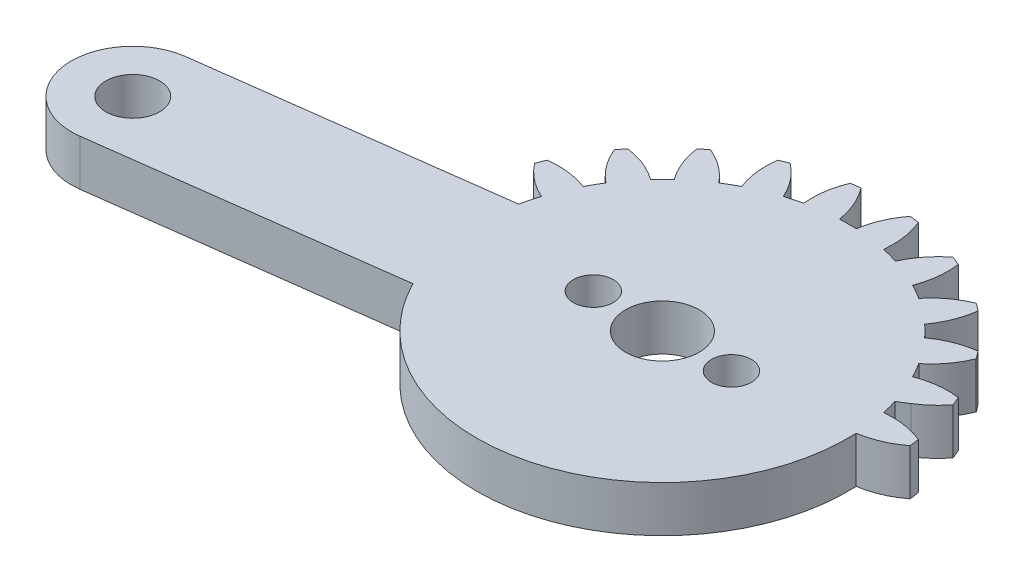
from build123d import *
from build123d.topology import SkipClean

# Parameters (mm, degrees)
SKETCH1_R           = 1.5
BOSS_EXTRUDE1_DEPTH = 3
BOSS_EXTRUDE2_START = -3
SKETCH3_R           = 1.5
SKETCH3_R_2         = 1.75
BOSS_EXTRUDE2_DEPTH = 3
CUT_EXTRUDE1_START  = -4
CUT_EXTRUDE1_DEPTH  = 4
CUT_EXTRUDE2_REACH  = 48.999
SKETCH5_R           = 2.4
SKETCH5_R_2         = 1.3


with BuildPart() as part:
    # Sketch1 → Boss-Extrude1 (new body)
    with BuildSketch(Plane(origin=(0, 0, 0), x_dir=(1, 0, 0), z_dir=(0, 1, 0))):
        with BuildLine():
            Line((20.643657446, 4), (2.081641936, 4))
            ThreePointArc((2.081641936, 4), (2.861028333, 4.588201733), (3.521749436, 5.30713988))
            ThreePointArc((3.521749436, 5.30713988), (3.405395609, 5.596745198), (3.282888305, 5.883801663))
            ThreePointArc((3.282888305, 5.883801663), (1.93527598, 5.894040025), (0.627094961, 5.57027124))
            ThreePointArc((0.627094961, 5.57027124), (0.366286148, 6.046375), (0.084372603, 6.510293938))
            ThreePointArc((0.084372603, 6.510293938), (1.018855105, 7.48132754), (1.683794586, 8.65351323))
            ThreePointArc((1.683794586, 8.65351323), (1.496450048, 8.903135899), (1.303821399, 9.148703928))
            ThreePointArc((1.303821399, 9.148703928), (-0.000522033, 8.809805691), (-1.180330337, 8.158486898))
            ThreePointArc((-1.180330337, 8.158486898), (-1.555477026, 8.550865528), (-1.947855656, 8.926012217))
            ThreePointArc((-1.947855656, 8.926012217), (-1.296536862, 10.105820521), (-0.957638625, 11.410163953))
            ThreePointArc((-0.957638625, 11.410163953), (-1.203206655, 11.602792602), (-1.452829324, 11.79013714))
            ThreePointArc((-1.452829324, 11.79013714), (-2.625015014, 11.125197659), (-3.596048616, 10.190715157))
            ThreePointArc((-3.596048616, 10.190715157), (-4.059967554, 10.472628702), (-4.536071314, 10.733437515))
            ThreePointArc((-4.536071314, 10.733437515), (-4.212302529, 12.041618533), (-4.222540891, 13.389230859))
            ThreePointArc((-4.222540891, 13.389230859), (-4.509597355, 13.511738163), (-4.799202674, 13.62809199))
            ThreePointArc((-4.799202674, 13.62809199), (-5.759348103, 12.682425791), (-6.455432668, 11.528463019))
            ThreePointArc((-6.455432668, 11.528463019), (-6.976508546, 11.680699536), (-7.503891752, 11.809396783))
            ThreePointArc((-7.503891752, 11.809396783), (-7.529737283, 13.156800143), (-7.888414517, 14.455843809))
            ThreePointArc((-7.888414517, 14.455843809), (-8.197396993, 14.499881098), (-8.507248835, 14.537314892))
            ThreePointArc((-8.507248835, 14.537314892), (-9.18992168, 13.375367565), (-9.563620196, 12.080565177))
            ThreePointArc((-9.563620196, 12.080565177), (-10.106342554, 12.09275), (-10.649064912, 12.080565177))
            ThreePointArc((-10.649064912, 12.080565177), (-11.022763428, 13.375367565), (-11.705436272, 14.537314892))
            ThreePointArc((-11.705436272, 14.537314892), (-12.015288115, 14.499881098), (-12.324270591, 14.455843809))
            ThreePointArc((-12.324270591, 14.455843809), (-12.682947825, 13.156800143), (-12.708793355, 11.809396783))
            ThreePointArc((-12.708793355, 11.809396783), (-13.236176561, 11.680699536), (-13.757252439, 11.528463019))
            ThreePointArc((-13.757252439, 11.528463019), (-14.453337005, 12.682425791), (-15.413482434, 13.62809199))
            ThreePointArc((-15.413482434, 13.62809199), (-15.703087752, 13.511738163), (-15.990144217, 13.389230859))
            ThreePointArc((-15.990144217, 13.389230859), (-16.000382579, 12.041618533), (-15.676613793, 10.733437515))
            ThreePointArc((-15.676613793, 10.733437515), (-16.152717554, 10.472628702), (-16.616636492, 10.190715157))
            ThreePointArc((-16.616636492, 10.190715157), (-17.587670094, 11.125197659), (-18.759855783, 11.79013714))
            ThreePointArc((-18.759855783, 11.79013714), (-19.009478453, 11.602792602), (-19.255046482, 11.410163953))
            ThreePointArc((-19.255046482, 11.410163953), (-18.916148245, 10.105820521), (-18.264829452, 8.926012217))
            ThreePointArc((-18.264829452, 8.926012217), (-18.657208082, 8.550865528), (-19.032354771, 8.158486898))
            ThreePointArc((-19.032354771, 8.158486898), (-20.212163074, 8.809805691), (-21.516506507, 9.148703928))
            ThreePointArc((-21.516506507, 9.148703928), (-21.709135156, 8.903135899), (-21.896479694, 8.65351323))
            ThreePointArc((-21.896479694, 8.65351323), (-21.231540213, 7.48132754), (-20.297057711, 6.510293938))
            ThreePointArc((-20.297057711, 6.510293938), (-20.578971255, 6.046375), (-20.839780068, 5.57027124))
            ThreePointArc((-20.839780068, 5.57027124), (-22.147961087, 5.894040025), (-23.495573413, 5.883801663))
            ThreePointArc((-23.495573413, 5.883801663), (-23.618080717, 5.596745198), (-23.734434544, 5.30713988))
            ThreePointArc((-23.734434544, 5.30713988), (-22.788768345, 4.346994451), (-21.634805572, 3.650909885))
            ThreePointArc((-21.634805572, 3.650909885), (-21.78704209, 3.129834008), (-21.915739337, 2.602450802))
            ThreePointArc((-21.915739337, 2.602450802), (-23.263142697, 2.576605271), (-24.562186363, 2.217928037))
            ThreePointArc((-24.562186363, 2.217928037), (-24.606223651, 1.908945561), (-24.643657446, 1.599093719))
            ThreePointArc((-24.643657446, 1.599093719), (-23.481710119, 0.916420874), (-22.186907731, 0.542722358))
            ThreePointArc((-22.186907731, 0.542722358), (-22.199092554, 0), (-22.186907731, -0.542722358))
            ThreePointArc((-22.186907731, -0.542722358), (-23.481710119, -0.916420874), (-24.643657446, -1.599093719))
            ThreePointArc((-24.643657446, -1.599093719), (-24.606223651, -1.908945561), (-24.562186363, -2.217928037))
            ThreePointArc((-24.562186363, -2.217928037), (-23.263142697, -2.576605271), (-21.915739337, -2.602450802))
            ThreePointArc((-21.915739337, -2.602450802), (-21.78704209, -3.129834008), (-21.634805572, -3.650909885))
            ThreePointArc((-21.634805572, -3.650909885), (-22.788768345, -4.346994451), (-23.734434544, -5.30713988))
            ThreePointArc((-23.734434544, -5.30713988), (-23.618080717, -5.596745198), (-23.495573413, -5.883801663))
            ThreePointArc((-23.495573413, -5.883801663), (-22.147961087, -5.894040025), (-20.839780068, -5.57027124))
            ThreePointArc((-20.839780068, -5.57027124), (-20.578971255, -6.046375), (-20.297057711, -6.510293938))
            ThreePointArc((-20.297057711, -6.510293938), (-21.231540213, -7.48132754), (-21.896479694, -8.65351323))
            ThreePointArc((-21.896479694, -8.65351323), (-21.709135156, -8.903135899), (-21.516506507, -9.148703928))
            ThreePointArc((-21.516506507, -9.148703928), (-20.212163074, -8.809805691), (-19.032354771, -8.158486898))
            ThreePointArc((-19.032354771, -8.158486898), (-18.657208082, -8.550865528), (-18.264829452, -8.926012217))
            ThreePointArc((-18.264829452, -8.926012217), (-18.916148245, -10.105820521), (-19.255046482, -11.410163953))
            ThreePointArc((-19.255046482, -11.410163953), (-19.009478453, -11.602792602), (-18.759855783, -11.79013714))
            ThreePointArc((-18.759855783, -11.79013714), (-17.587670094, -11.125197659), (-16.616636492, -10.190715157))
            ThreePointArc((-16.616636492, -10.190715157), (-16.152717554, -10.472628702), (-15.676613793, -10.733437515))
            ThreePointArc((-15.676613793, -10.733437515), (-16.000382579, -12.041618533), (-15.990144217, -13.389230859))
            ThreePointArc((-15.990144217, -13.389230859), (-15.703087752, -13.511738163), (-15.413482434, -13.62809199))
            ThreePointArc((-15.413482434, -13.62809199), (-14.453337005, -12.682425791), (-13.757252439, -11.528463019))
            ThreePointArc((-13.757252439, -11.528463019), (-13.236176561, -11.680699536), (-12.708793355, -11.809396783))
            ThreePointArc((-12.708793355, -11.809396783), (-12.682947825, -13.156800143), (-12.324270591, -14.455843809))
            ThreePointArc((-12.324270591, -14.455843809), (-12.015288115, -14.499881098), (-11.705436272, -14.537314892))
            ThreePointArc((-11.705436272, -14.537314892), (-11.022763428, -13.375367565), (-10.649064912, -12.080565177))
            ThreePointArc((-10.649064912, -12.080565177), (-10.106342554, -12.09275), (-9.563620196, -12.080565177))
            ThreePointArc((-9.563620196, -12.080565177), (-9.18992168, -13.375367565), (-8.507248835, -14.537314892))
            ThreePointArc((-8.507248835, -14.537314892), (-8.197396993, -14.499881098), (-7.888414517, -14.455843809))
            ThreePointArc((-7.888414517, -14.455843809), (-7.529737283, -13.156800143), (-7.503891752, -11.809396783))
            ThreePointArc((-7.503891752, -11.809396783), (-6.976508546, -11.680699536), (-6.455432668, -11.528463019))
            ThreePointArc((-6.455432668, -11.528463019), (-5.759348103, -12.682425791), (-4.799202674, -13.62809199))
            ThreePointArc((-4.799202674, -13.62809199), (-4.509597355, -13.511738163), (-4.222540891, -13.389230859))
            ThreePointArc((-4.222540891, -13.389230859), (-4.212302529, -12.041618533), (-4.536071314, -10.733437515))
            ThreePointArc((-4.536071314, -10.733437515), (-4.059967554, -10.472628702), (-3.596048616, -10.190715157))
            ThreePointArc((-3.596048616, -10.190715157), (-2.625015014, -11.125197659), (-1.452829324, -11.79013714))
            ThreePointArc((-1.452829324, -11.79013714), (-1.203206655, -11.602792602), (-0.957638625, -11.410163953))
            ThreePointArc((-0.957638625, -11.410163953), (-1.296536862, -10.105820521), (-1.947855656, -8.926012217))
            ThreePointArc((-1.947855656, -8.926012217), (-1.555477026, -8.550865528), (-1.180330337, -8.158486898))
            ThreePointArc((-1.180330337, -8.158486898), (-0.000522033, -8.809805691), (1.303821399, -9.148703928))
            ThreePointArc((1.303821399, -9.148703928), (1.496450048, -8.903135899), (1.683794586, -8.65351323))
            ThreePointArc((1.683794586, -8.65351323), (1.018855105, -7.48132754), (0.084372603, -6.510293938))
            ThreePointArc((0.084372603, -6.510293938), (0.366286148, -6.046375), (0.627094961, -5.57027124))
            ThreePointArc((0.627094961, -5.57027124), (1.93527598, -5.894040025), (3.282888305, -5.883801663))
            ThreePointArc((3.282888305, -5.883801663), (3.405395609, -5.596745198), (3.521749436, -5.30713988))
            ThreePointArc((3.521749436, -5.30713988), (2.861028333, -4.588201733), (2.081641936, -4))
            Line((2.081641936, -4), (20.643657446, -4))
            ThreePointArc((20.643657446, -4), (24.643657446, 0), (20.643657446, 4))
        make_face()
        with Locations((-10.106342554, 0)):
            Circle(SKETCH1_R, mode=Mode.SUBTRACT)
        with Locations((20.643657446, 0)):
            Circle(SKETCH1_R, mode=Mode.SUBTRACT)
    extrude(amount=BOSS_EXTRUDE1_DEPTH)

    # Sketch3 → Boss-Extrude2 (add)
    with BuildSketch(Plane(origin=(0, 3, 0), x_dir=(1, 0, 0), z_dir=(0, 1, 0)).offset(BOSS_EXTRUDE2_START)):
        with BuildLine():
            Line((-10.628447323, 3.965779445), (-41.11537681, -0.047900965))
            ThreePointArc((-41.11537681, -0.047900965), (-44.559051487, -4.53578518), (-40.071167272, -7.979459856))
            Line((-40.071167272, -7.979459856), (-9.584237785, -3.965779445))
            ThreePointArc((-9.584237785, -3.965779445), (-6.140563108, 0.522104769), (-10.628447323, 3.965779445))
        make_face()
        with Locations((-10.106342554, 0)):
            Circle(SKETCH3_R, mode=Mode.SUBTRACT)
        with Locations((-40.593272041, -4.013680411)):
            Circle(SKETCH3_R_2, mode=Mode.SUBTRACT)
    extrude(amount=BOSS_EXTRUDE2_DEPTH)

    # Sketch4 → Cut-Extrude1 (cut)
    with SkipClean():  # the faces are left unmerged after this step: merging them gives an invalid solid
        with BuildSketch(Plane(origin=(0, 3, 0), x_dir=(1, 0, 0), z_dir=(0, 1, 0)).offset(CUT_EXTRUDE1_START)):
            with BuildLine():
                ThreePointArc((20.643657446, -4), (24.643657446, 0), (20.643657446, 4))
                Line((20.643657446, 4), (2.081641936, 4))
                Line((2.081641936, 4), (1.43808022, 3.600125745))
                ThreePointArc((1.43808022, 3.600125745), (1.581217534, 3.104116905), (1.70305423, 2.602450802))
                ThreePointArc((1.70305423, 2.602450802), (3.050457589, 2.576605271), (4.349501255, 2.217928037))
                ThreePointArc((4.349501255, 2.217928037), (4.393538544, 1.908945561), (4.430972339, 1.599093719))
                ThreePointArc((4.430972339, 1.599093719), (3.269025011, 0.916420874), (1.974222624, 0.542722358))
                ThreePointArc((1.974222624, 0.542722358), (1.70305423, -2.602450802), (0.627094961, -5.57027124))
                ThreePointArc((0.627094961, -5.57027124), (1.93527598, -5.894040025), (3.282888305, -5.883801663))
                ThreePointArc((3.282888305, -5.883801663), (3.405395609, -5.596745198), (3.521749436, -5.30713988))
                ThreePointArc((3.521749436, -5.30713988), (2.861028333, -4.588201733), (2.081641936, -4))
                Line((2.081641936, -4), (20.643657446, -4))
            make_face()
            with BuildLine():
                ThreePointArc((1.683794586, -8.65351323), (1.018855105, -7.48132754), (0.084372603, -6.510293938))
                ThreePointArc((0.084372603, -6.510293938), (-0.512518948, -7.361599771), (-1.180330337, -8.158486898))
                ThreePointArc((-1.180330337, -8.158486898), (-0.000522033, -8.809805691), (1.303821399, -9.148703928))
                ThreePointArc((1.303821399, -9.148703928), (1.496450048, -8.903135899), (1.683794586, -8.65351323))
            make_face()
            with BuildLine():
                ThreePointArc((-0.957638625, -11.410163953), (-1.296536862, -10.105820521), (-1.947855656, -8.926012217))
                ThreePointArc((-1.947855656, -8.926012217), (-2.744742783, -9.593823606), (-3.596048616, -10.190715157))
                ThreePointArc((-3.596048616, -10.190715157), (-2.625015014, -11.125197659), (-1.452829324, -11.79013714))
                ThreePointArc((-1.452829324, -11.79013714), (-1.203206655, -11.602792602), (-0.957638625, -11.410163953))
            make_face()
            with BuildLine():
                ThreePointArc((-4.222540891, -13.389230859), (-4.212302529, -12.041618533), (-4.536071314, -10.733437515))
                ThreePointArc((-4.536071314, -10.733437515), (-5.478647477, -11.172244217), (-6.455432668, -11.528463019))
                ThreePointArc((-6.455432668, -11.528463019), (-5.759348103, -12.682425791), (-4.799202674, -13.62809199))
                ThreePointArc((-4.799202674, -13.62809199), (-4.509597355, -13.511738163), (-4.222540891, -13.389230859))
            make_face()
            with BuildLine():
                ThreePointArc((-7.888414517, -14.455843809), (-7.529737283, -13.156800143), (-7.503891752, -11.809396783))
                ThreePointArc((-7.503891752, -11.809396783), (-8.527921943, -11.989294847), (-9.563620196, -12.080565177))
                ThreePointArc((-9.563620196, -12.080565177), (-9.18992168, -13.375367565), (-8.507248835, -14.537314892))
                ThreePointArc((-8.507248835, -14.537314892), (-8.197396993, -14.499881098), (-7.888414517, -14.455843809))
            make_face()
            with BuildLine():
                ThreePointArc((-11.705436272, -14.537314892), (-11.022763428, -13.375367565), (-10.649064912, -12.080565177))
                ThreePointArc((-10.649064912, -12.080565177), (-11.684763165, -11.989294847), (-12.708793355, -11.809396783))
                ThreePointArc((-12.708793355, -11.809396783), (-12.682947825, -13.156800143), (-12.324270591, -14.455843809))
                ThreePointArc((-12.324270591, -14.455843809), (-12.015288115, -14.499881098), (-11.705436272, -14.537314892))
            make_face()
            with BuildLine():
                ThreePointArc((-15.413482434, -13.62809199), (-14.453337005, -12.682425791), (-13.757252439, -11.528463019))
                ThreePointArc((-13.757252439, -11.528463019), (-14.734037631, -11.172244217), (-15.676613793, -10.733437515))
                ThreePointArc((-15.676613793, -10.733437515), (-16.000382579, -12.041618533), (-15.990144217, -13.389230859))
                ThreePointArc((-15.990144217, -13.389230859), (-15.703087752, -13.511738163), (-15.413482434, -13.62809199))
            make_face()
            with BuildLine():
                ThreePointArc((-18.759855783, -11.79013714), (-17.587670094, -11.125197659), (-16.616636492, -10.190715157))
                ThreePointArc((-16.616636492, -10.190715157), (-17.467942324, -9.593823606), (-18.264829452, -8.926012217))
                ThreePointArc((-18.264829452, -8.926012217), (-18.916148245, -10.105820521), (-19.255046482, -11.410163953))
                ThreePointArc((-19.255046482, -11.410163953), (-19.009478453, -11.602792602), (-18.759855783, -11.79013714))
            make_face()
            with BuildLine():
                ThreePointArc((-21.516506507, -9.148703928), (-20.212163074, -8.809805691), (-19.032354771, -8.158486898))
                ThreePointArc((-19.032354771, -8.158486898), (-19.70016616, -7.361599771), (-20.297057711, -6.510293938))
                ThreePointArc((-20.297057711, -6.510293938), (-21.231540213, -7.48132754), (-21.896479694, -8.65351323))
                ThreePointArc((-21.896479694, -8.65351323), (-21.709135156, -8.903135899), (-21.516506507, -9.148703928))
            make_face()
            with BuildLine():
                ThreePointArc((-21.942853375, 2.47620963), (-21.92946485, 2.539366405), (-21.915739337, 2.602450802))
                ThreePointArc((-21.915739337, 2.602450802), (-23.263142697, 2.576605271), (-24.562186363, 2.217928037))
                ThreePointArc((-24.562186363, 2.217928037), (-24.56889027, 2.173784387), (-24.575459377, 2.129620475))
                Line((-24.575459377, 2.129620475), (-21.942853375, 2.47620963))
            make_face()
            with BuildLine():
                ThreePointArc((-23.495573413, -5.883801663), (-22.147961087, -5.894040025), (-20.839780068, -5.57027124))
                ThreePointArc((-20.839780068, -5.57027124), (-20.869365339, -5.512888815), (-20.898643838, -5.455349261))
                Line((-20.898643838, -5.455349261), (-23.531249839, -5.801938416))
                ThreePointArc((-23.531249839, -5.801938416), (-23.513474108, -5.842897269), (-23.495573413, -5.883801663))
            make_face()
        extrude(amount=CUT_EXTRUDE1_DEPTH, mode=Mode.SUBTRACT)

    # Sketch5 → Cut-Extrude2 (cut, up to next)
    with BuildSketch(Plane(origin=(0, 3, 0), x_dir=(1, 0, 0), z_dir=(0, 1, 0)), mode=Mode.PRIVATE) as cut_extrude2_sk1:
        with Locations((-10.106342554, 0)):
            Circle(SKETCH5_R)
    cut_extrude2_tool1 = extrude(cut_extrude2_sk1.sketch, amount=-CUT_EXTRUDE2_REACH, mode=Mode.PRIVATE) & part.part
    # Sketch5 → Cut-Extrude2 (cut, up to next)
    with BuildSketch(Plane(origin=(0, 3, 0), x_dir=(1, 0, 0), z_dir=(0, 1, 0)), mode=Mode.PRIVATE) as cut_extrude2_sk2:
        with Locations((-5.606342554, 0)):
            Circle(SKETCH5_R_2)
    cut_extrude2_tool2 = extrude(cut_extrude2_sk2.sketch, amount=-CUT_EXTRUDE2_REACH, mode=Mode.PRIVATE) & part.part
    # Sketch5 → Cut-Extrude2 (cut, up to next)
    with BuildSketch(Plane(origin=(0, 3, 0), x_dir=(1, 0, 0), z_dir=(0, 1, 0)), mode=Mode.PRIVATE) as cut_extrude2_sk3:
        with Locations((-14.606342554, 0)):
            Circle(SKETCH5_R_2)
    cut_extrude2_tool3 = extrude(cut_extrude2_sk3.sketch, amount=-CUT_EXTRUDE2_REACH, mode=Mode.PRIVATE) & part.part
    add(cut_extrude2_tool1.solids().sort_by_distance((-10.106343, 3, 0))[0], mode=Mode.SUBTRACT)
    add(cut_extrude2_tool2.solids().sort_by_distance((-5.606343, 3, 0))[0], mode=Mode.SUBTRACT)
    add(cut_extrude2_tool3.solids().sort_by_distance((-14.606343, 3, 0))[0], mode=Mode.SUBTRACT)


solid = part.part
